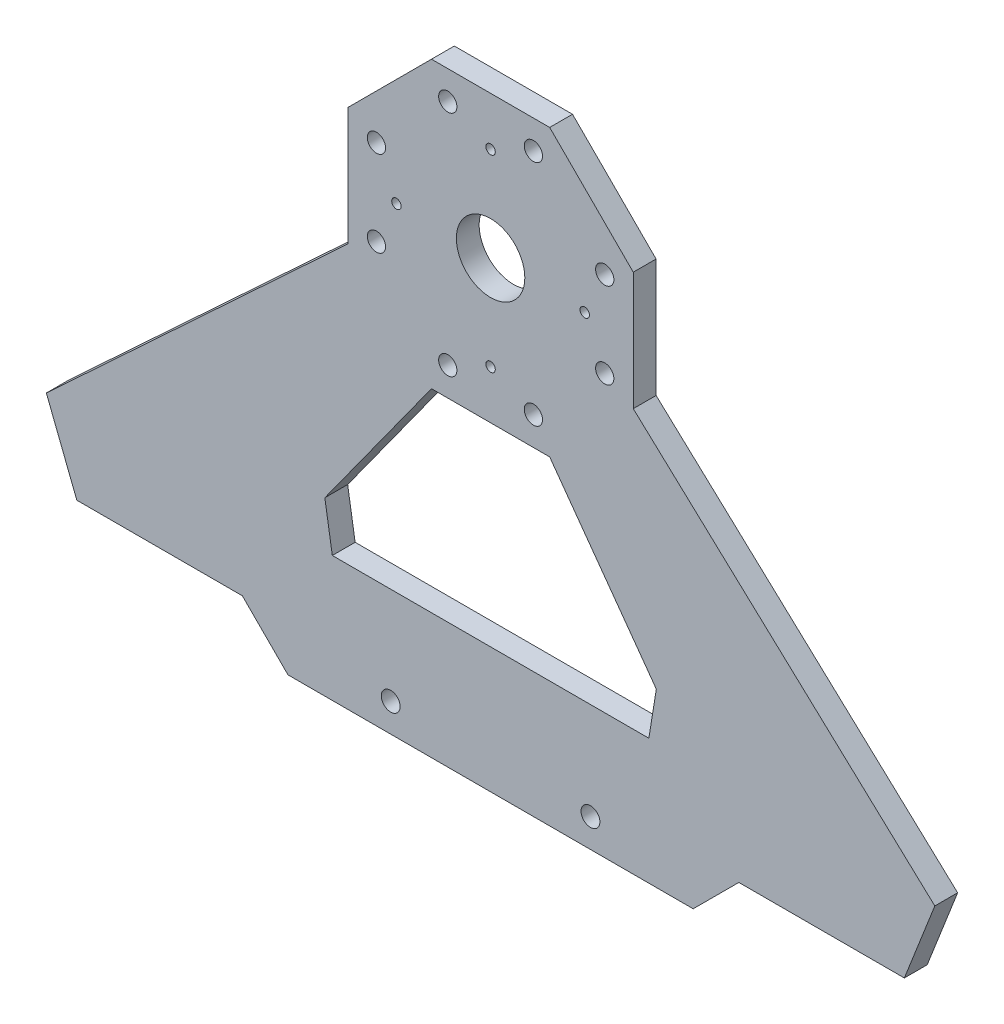
from build123d import *
from OCP.BRepFilletAPI import BRepFilletAPI_MakeChamfer

# Parameters (mm, degrees)
SKETCH_2_R          = 0.825
SKETCH_2_R_2        = 6
EXTRUDE_1_DEPTH     = 2
SKETCH_4_R          = 1.6
CUT_EXTRUDE_1_DEPTH = 15
EXTRUDE_2_DEPTH     = 2
EXTRUDE_3_DEPTH     = 2
CHAMFER_2_SIZE      = 20
SKETCH_8_W          = 95
SKETCH_8_H          = 22
EXTRUDE_4_DEPTH     = 2
CHAMFER_3_SIZE      = 12
CHAMFER_4_SIZE      = 10
CHAMFER_4_SIZE2     = 7.162801166
SKETCH_10_R         = 1.65
CUT_EXTRUDE_2_DEPTH = 14


with BuildPart() as part:
    # 草图2 → 凸台-拉伸1 (new, symmetric)
    with BuildSketch(Plane.XY):
        Polygon((10.355339059, 25), (-10.355339059, 25), (-25, 10.355339059), (-25, -10.355339059), (-10.355339059, -25), (10.355339059, -25), (25, -10.355339059), (25, 10.355339059), align=None)
        with Locations((-16.5, 0)):
            Circle(SKETCH_2_R, mode=Mode.SUBTRACT)
        with Locations((0, 16.5)):
            Circle(SKETCH_2_R, mode=Mode.SUBTRACT)
        with Locations((16.5, 0)):
            Circle(SKETCH_2_R, mode=Mode.SUBTRACT)
        with Locations((0, -16.5)):
            Circle(SKETCH_2_R, mode=Mode.SUBTRACT)
        Circle(SKETCH_2_R_2, mode=Mode.SUBTRACT)
    extrude(amount=EXTRUDE_1_DEPTH, both=True)

    # 草图4 → 切除-拉伸1 (cut)
    with BuildSketch(Plane(origin=(0, 0, -2), x_dir=(-1, 0, 0), z_dir=(0, 0, -1))):
        with Locations((-7.5, -20)):
            Circle(SKETCH_4_R)
        with Locations(Location((7.5, -20, 0), (0, 0, 180))):
            Circle(SKETCH_4_R)
        with Locations((-20, 7.5)):
            Circle(SKETCH_4_R)
        with Locations(Location((-20, -7.5, 0), (0, 0, 180))):
            Circle(SKETCH_4_R)
        with Locations((7.5, 20)):
            Circle(SKETCH_4_R)
        with Locations(Location((-7.5, 20, 0), (0, 0, 180))):
            Circle(SKETCH_4_R)
        with Locations((20, -7.5)):
            Circle(SKETCH_4_R)
        with Locations(Location((20, 7.5, 0), (0, 0, 180))):
            Circle(SKETCH_4_R)
    extrude(amount=-CUT_EXTRUDE_1_DEPTH, mode=Mode.SUBTRACT)

    # 草图5 → 凸台-拉伸2 (add, symmetric)
    with BuildSketch(Plane.XY):
        Polygon((-25, -10.355339059), (-92.5, -73), (-70, -73), (-16.17766953, -19.17766953), align=None)
        Polygon((70, -73), (92.5, -73), (25, -10.355339059), (16.17766953, -19.17766953), align=None)
    extrude(amount=EXTRUDE_2_DEPTH, both=True)

    # 草图6 → 凸台-拉伸3 (add, symmetric)
    with BuildSketch(Plane.XY):
        Polygon((-70, -73), (-45, -73), (-10.355339059, -25), (-16.17766953, -19.17766953), align=None)
        Polygon((70, -73), (16.17766953, -19.17766953), (10.355339059, -25), (45, -73), align=None)
    extrude(amount=EXTRUDE_3_DEPTH, both=True)

    # 倒角2
    chamfer_2_edges = [part.edges().sort_by_distance(p)[0] for p in [
        (-92.5, -73, 0),
        (92.5, -73, 0),
    ]]
    chamfer(chamfer_2_edges, length=CHAMFER_2_SIZE)

    # 草图8 → 凸台-拉伸4 (add, symmetric)
    with BuildSketch(Plane.XY):
        with Locations((0, -70)):
            Rectangle(SKETCH_8_W, SKETCH_8_H)
    extrude(amount=EXTRUDE_4_DEPTH, both=True)

    # 倒角3
    # the kernel refuses this chamfer: 12 mm, written as the material it takes off along each edge
    with BuildSketch(Plane(origin=(47.5, -81, -32.860195856), x_dir=(0.02749587661058619, 0.9996219169112968, 0), z_dir=(0, 0, 1))) as chamfer_3_piece_1_section:
        Polygon((CHAMFER_3_SIZE * 0.999621916911, CHAMFER_3_SIZE * 0.0274958766106), (-CHAMFER_3_SIZE * 0.0274958766106, CHAMFER_3_SIZE * 0.999621916911), (0, 0), align=None)
    chamfer_3_piece_1 = extrude(amount=65.720391711, mode=Mode.PRIVATE)
    chamfer_3_piece_1 = split(chamfer_3_piece_1, bisect_by=Plane(origin=(43.13163598, -73, 0), z_dir=(0, -1, 0)), keep=Keep.TOP, mode=Mode.PRIVATE)
    add(chamfer_3_piece_1, mode=Mode.SUBTRACT)
    with BuildSketch(Plane(origin=(-47.5, -81, 32.860195856), x_dir=(-0.02749587661058619, 0.9996219169112968, 0), z_dir=(0, 0, -1))) as chamfer_3_piece_2_section:
        Polygon((CHAMFER_3_SIZE * 0.999621916911, CHAMFER_3_SIZE * 0.0274958766106), (-CHAMFER_3_SIZE * 0.0274958766106, CHAMFER_3_SIZE * 0.999621916911), (0, 0), align=None)
    chamfer_3_piece_2 = extrude(amount=65.720391711, mode=Mode.PRIVATE)
    chamfer_3_piece_2 = split(chamfer_3_piece_2, bisect_by=Plane(origin=(-43.13163598, -73, 0), z_dir=(0, -1, 0)), keep=Keep.TOP, mode=Mode.PRIVATE)
    add(chamfer_3_piece_2, mode=Mode.SUBTRACT)

    # 倒角4: one chamfer whose edges measure the first distance from different faces: ONE call of the kernel's chamfer builder (chamfer() names one face for all edges)
    chamfer_4_edges_1 = [part.edges().sort_by_distance(p)[0] for p in [
        (34.895307226, -59, 0),
    ]]
    chamfer_4_side_1 = [part.faces().sort_by_distance(p)[0] for p in [
        (22.625323142, -42, 0),
    ]]
    chamfer_4_edges_2 = [part.edges().sort_by_distance(p)[0] for p in [
        (-34.895307226, -59, 0),
    ]]
    chamfer_4_side_2 = [part.faces().sort_by_distance(p)[0] for p in [
        (-22.625323142, -42, 0),
    ]]
    chamfer_4 = BRepFilletAPI_MakeChamfer(part.part.solid().wrapped)
    for e in chamfer_4_edges_1:
        chamfer_4.Add(CHAMFER_4_SIZE, CHAMFER_4_SIZE2, e.wrapped, chamfer_4_side_1[0].wrapped)  # the first distance lies on this face
    for e in chamfer_4_edges_2:
        chamfer_4.Add(CHAMFER_4_SIZE, CHAMFER_4_SIZE2, e.wrapped, chamfer_4_side_2[0].wrapped)  # the first distance lies on this face
    add(Compound.cast(chamfer_4.Shape()), mode=Mode.REPLACE)

    # 草图10 → 切除-拉伸2 (cut)
    with BuildSketch(Plane.XY.offset(2)):
        with Locations((-17.5, -76)):
            Circle(SKETCH_10_R)
        with Locations((17.5, -76)):
            Circle(SKETCH_10_R)
    extrude(amount=-CUT_EXTRUDE_2_DEPTH, mode=Mode.SUBTRACT)


solid = part.part
